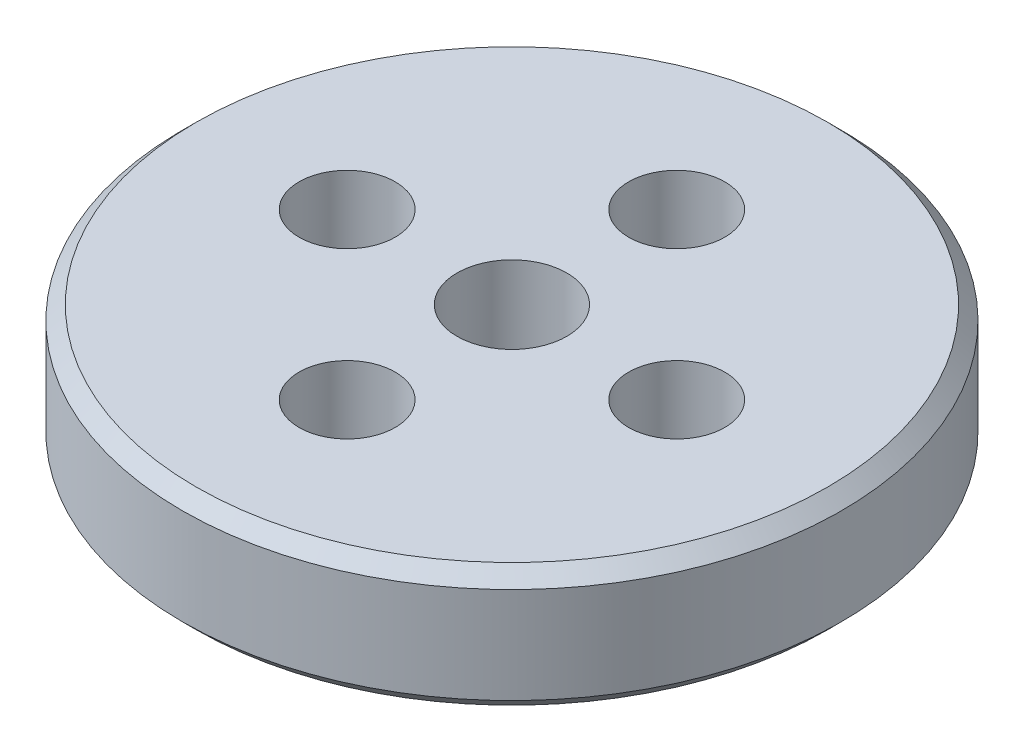
from build123d import *

# Parameters (mm, degrees)
SKETCH2_R           = 24
SKETCH2_R_2         = 18
BOSS_EXTRUDE2_DEPTH = 9
BOSS_EXTRUDE3_START = 2
SKETCH2_3_R         = 18
SKETCH2_3_R_2       = 16
SKETCH2_3_R_3       = 3.5
SKETCH2_3_R_4       = 4
BOSS_EXTRUDE3_DEPTH = 7
CHAMFER1_SIZE       = 1
CHAMFER2_SIZE       = 2


with BuildPart() as part:
    # Sketch2 → Boss-Extrude2 (new body)
    with BuildSketch(Plane(origin=(0, 0, 0), x_dir=(1, 0, 0), z_dir=(0, 1, 0))):
        with Locations(Location((0, 0, 0), (0, 0, 270))):
            Circle(SKETCH2_R)
        with Locations(Location((0, 0, 0), (0, 0, 270))):
            Circle(SKETCH2_R_2, mode=Mode.SUBTRACT)
    extrude(amount=BOSS_EXTRUDE2_DEPTH)

    # Sketch2<3> → Boss-Extrude3 (add)
    # profile 1 of 2: a face of its own
    with BuildSketch(Plane(origin=(0, 0, 0), x_dir=(1, 0, 0), z_dir=(0, 1, 0)).offset(BOSS_EXTRUDE3_START)):
        with Locations(Location((0, 0, 0), (0, 0, 270))):
            Circle(SKETCH2_3_R)
        Circle(SKETCH2_3_R_2, mode=Mode.SUBTRACT)
    # profile 2 of 2: a face of its own
    with BuildSketch(Plane(origin=(0, 0, 0), x_dir=(1, 0, 0), z_dir=(0, 1, 0)).offset(BOSS_EXTRUDE3_START)):
        Circle(SKETCH2_3_R_2)
        with Locations(Location((-12, 0, 0), (0, 0, 270))):
            Circle(SKETCH2_3_R_3, mode=Mode.SUBTRACT)
        with Locations(Location((0, -12, 0), (0, 0, 270))):
            Circle(SKETCH2_3_R_3, mode=Mode.SUBTRACT)
        with Locations(Location((12, 0, 0), (0, 0, 270))):
            Circle(SKETCH2_3_R_3, mode=Mode.SUBTRACT)
        with Locations(Location((0, 12, 0), (0, 0, 270))):
            Circle(SKETCH2_3_R_3, mode=Mode.SUBTRACT)
        with Locations(Location((0, 0, 0), (0, 0, 270))):
            Circle(SKETCH2_3_R_4, mode=Mode.SUBTRACT)
    extrude(amount=BOSS_EXTRUDE3_DEPTH)

    # Chamfer1
    chamfer1_edges = [part.edges().sort_by_distance(p)[0] for p in [
        (0, 9, -24),
        (0, 0, -24),
    ]]
    chamfer(chamfer1_edges, length=CHAMFER1_SIZE)

    # Chamfer2
    chamfer2_edges = [part.edges().sort_by_distance(p)[0] for p in [
        (0, 2, -18),
    ]]
    chamfer(chamfer2_edges, length=CHAMFER2_SIZE - 0.0001)  # a hair under: the kernel refuses the full size


solid = part.part
